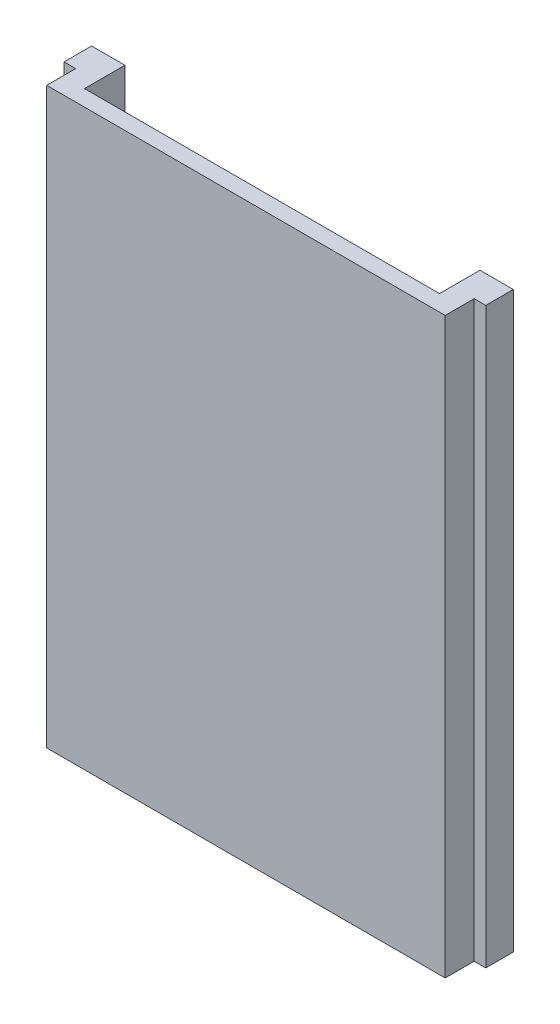
from build123d import *

# Parameters (mm, degrees)
SALIENTE_EXTRUIR4_DEPTH = 198


with BuildPart() as part:
    # Croquis1 → Saliente-Extruir4 (new body)
    with BuildSketch(Plane(origin=(0, 0, 0), x_dir=(1, 0, 0), z_dir=(0, 1, 0))):
        Polygon((-4, 10), (-4, 19.5), (7.5, 19.5), (7.5, 5.536148668), (130, 5.536148668), (130, 19.5), (141.5, 19.5), (141.5, 10), (137.5, 10), (137.5, 0), (0, 0), (0, 10), align=None)
    extrude(amount=SALIENTE_EXTRUIR4_DEPTH)


solid = part.part
